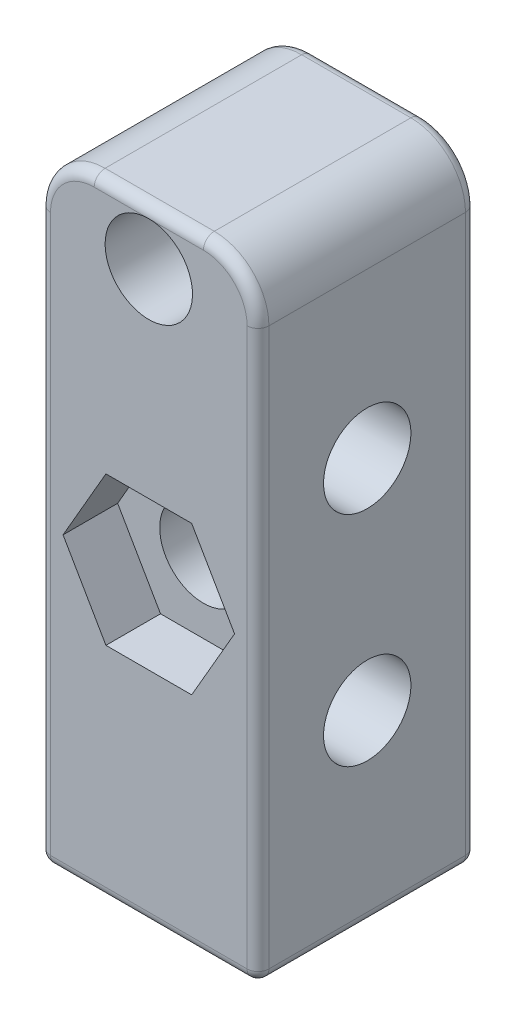
from build123d import *

# Parameters (mm, degrees)
SALIENTE_EXTRUIR1_DEPTH      = 50
SALIENTE_EXTRUIR1_DEPTH_BACK = 7
CROQUIS1_W                   = 20
CROQUIS1_H                   = 20
CROQUIS2_R                   = 4
CORTAR_EXTRUIR1_DEPTH        = 58.445626465
CORTAR_EXTRUIR2_DEPTH        = 5
CROQUIS4_R                   = 4
CORTAR_EXTRUIR3_DEPTH        = 58.445626465
CORTAR_EXTRUIR4_DEPTH        = 5
REDONDEO1_R                  = 5
REDONDEO2_R                  = 1
REDONDEO3_R                  = 1


with BuildPart() as part:
    # Croquis1 → Saliente-Extruir1 (new, two sides: drawn at the far end of the back side and taken through both)
    with BuildSketch(Plane(origin=(0, 0, 0), x_dir=(1, 0, 0), z_dir=(0, 1, 0)).offset(-SALIENTE_EXTRUIR1_DEPTH_BACK)):
        with Locations((10, 10)):
            Rectangle(CROQUIS1_W, CROQUIS1_H)
    extrude(amount=SALIENTE_EXTRUIR1_DEPTH + SALIENTE_EXTRUIR1_DEPTH_BACK)

    # Croquis2 → Cortar-Extruir1 (cut, through all)
    with BuildSketch(Plane.XY):
        with Locations((10, 45)):
            Circle(CROQUIS2_R)
        with Locations((10, 20)):
            Circle(CROQUIS2_R)
    extrude(amount=-CORTAR_EXTRUIR1_DEPTH, mode=Mode.SUBTRACT)

    # Croquis3 → Cortar-Extruir2 (cut)
    with BuildSketch(Plane.XY):
        Polygon((13.92598183, 26.8), (6.07401817, 26.8), (2.148036339, 20), (6.07401817, 13.2), (13.92598183, 13.2), (17.851963661, 20), align=None)
    extrude(amount=-CORTAR_EXTRUIR2_DEPTH, mode=Mode.SUBTRACT)

    # Croquis4 → Cortar-Extruir3 (cut, through all)
    with BuildSketch(Plane.ZY):
        with Locations((-10, 30)):
            Circle(CROQUIS4_R)
        with Locations((-10, 10)):
            Circle(CROQUIS4_R)
    extrude(amount=-CORTAR_EXTRUIR3_DEPTH, mode=Mode.SUBTRACT)

    # Croquis5 → Cortar-Extruir4 (cut)
    with BuildSketch(Plane.ZY):
        Polygon((-6.07401817, 23.2), (-2.148036339, 30), (-6.07401817, 36.8), (-13.92598183, 36.8), (-17.851963661, 30), (-13.92598183, 23.2), align=None)
        Polygon((-6.07401817, 16.8), (-13.92598183, 16.8), (-17.851963661, 10), (-13.92598183, 3.2), (-6.07401817, 3.2), (-2.148036339, 10), align=None)
    extrude(amount=-CORTAR_EXTRUIR4_DEPTH, mode=Mode.SUBTRACT)

    # Redondeo1
    redondeo1_edges = [part.edges().sort_by_distance(p)[0] for p in [
        (0, 50, -10),
        (20, 50, -10),
    ]]
    fillet(redondeo1_edges, radius=REDONDEO1_R)

    # Redondeo2
    redondeo2_edges = [part.edges().sort_by_distance(p)[0] for p in [
        (20, -7, -10),
        (10, -7, -20),
        (0, -7, -10),
        (10, -7, 0),
    ]]
    fillet(redondeo2_edges, radius=REDONDEO2_R)

    # Redondeo3
    # the kernel refuses this fillet: 1 mm, written as the material it takes off along each edge
    with BuildSketch(Plane(origin=(19, -6, -19), x_dir=(0, 0, -1), z_dir=(1, 0, 0))) as redondeo3_piece_1_section:
        Polygon((0, 0), (REDONDEO3_R, 0), (REDONDEO3_R, -REDONDEO3_R), (0, -REDONDEO3_R), align=None)
    redondeo3_piece_1 = extrude(amount=REDONDEO3_R, mode=Mode.PRIVATE)
    redondeo3_piece_1 = redondeo3_piece_1 - Plane(origin=(19, -6, -19), x_dir=(0, 0.7071067811865475, 0.7071067811865475), z_dir=(1, 0, 0)) * Sphere(REDONDEO3_R, mode=Mode.PRIVATE)
    add(redondeo3_piece_1, mode=Mode.SUBTRACT)
    with BuildSketch(Plane(origin=(19, -6, -1), x_dir=(1, 0, 0), z_dir=(0, 0, 1))) as redondeo3_piece_2_section:
        Polygon((0, 0), (REDONDEO3_R, 0), (REDONDEO3_R, -REDONDEO3_R), (0, -REDONDEO3_R), align=None)
    redondeo3_piece_2 = extrude(amount=REDONDEO3_R, mode=Mode.PRIVATE)
    redondeo3_piece_2 = redondeo3_piece_2 - Plane(origin=(19, -6, -1), x_dir=(-0.7071067811865475, 0.7071067811865475, 0), z_dir=(0, 0, 1)) * Sphere(REDONDEO3_R, mode=Mode.PRIVATE)
    add(redondeo3_piece_2, mode=Mode.SUBTRACT)
    with BuildSketch(Plane(origin=(1, -6, -19), x_dir=(0, 0, -1), z_dir=(-1, 0, 0))) as redondeo3_piece_3_section:
        Polygon((0, 0), (REDONDEO3_R, 0), (REDONDEO3_R, REDONDEO3_R), (0, REDONDEO3_R), align=None)
    redondeo3_piece_3 = extrude(amount=REDONDEO3_R, mode=Mode.PRIVATE)
    redondeo3_piece_3 = redondeo3_piece_3 - Plane(origin=(1, -6, -19), x_dir=(0, 0.7071067811865475, 0.7071067811865475), z_dir=(-1, 0, 0)) * Sphere(REDONDEO3_R, mode=Mode.PRIVATE)
    add(redondeo3_piece_3, mode=Mode.SUBTRACT)
    with BuildSketch(Plane(origin=(1, -6, -1), x_dir=(-1, 0, 0), z_dir=(0, 0, 1))) as redondeo3_piece_4_section:
        Polygon((0, 0), (REDONDEO3_R, 0), (REDONDEO3_R, REDONDEO3_R), (0, REDONDEO3_R), align=None)
    redondeo3_piece_4 = extrude(amount=REDONDEO3_R, mode=Mode.PRIVATE)
    redondeo3_piece_4 = redondeo3_piece_4 - Plane(origin=(1, -6, -1), x_dir=(0.7071067811865475, 0.7071067811865475, 0), z_dir=(0, 0, 1)) * Sphere(REDONDEO3_R, mode=Mode.PRIVATE)
    add(redondeo3_piece_4, mode=Mode.SUBTRACT)
    with BuildSketch(Plane(origin=(5, 50, 0), x_dir=(0, -1, 0), z_dir=(1, 0, 0))) as redondeo3_piece_5:
        with BuildLine():
            CenterArc((REDONDEO3_R, REDONDEO3_R), REDONDEO3_R, 180, 90)
            Line((0, REDONDEO3_R), (0, 0))
            Line((0, 0), (REDONDEO3_R, 0))
        make_face()
    extrude(amount=10, mode=Mode.SUBTRACT)
    with BuildSketch(Plane(origin=(15, 50, -20), x_dir=(0, 0, 1), z_dir=(-1, 0, 0))) as redondeo3_piece_6:
        with BuildLine():
            CenterArc((REDONDEO3_R, -REDONDEO3_R), REDONDEO3_R, 90, 90)
            Line((0, -REDONDEO3_R), (0, 0))
            Line((0, 0), (REDONDEO3_R, 0))
        make_face()
    extrude(amount=10, mode=Mode.SUBTRACT)
    with BuildSketch(Plane(origin=(5, 45, -20), x_dir=(-1, 0, 0), z_dir=(0, -1, 0))) as redondeo3_piece_7:
        with BuildLine():
            CenterArc((5 - REDONDEO3_R, -REDONDEO3_R), REDONDEO3_R, 0, 90)
            Line((5 - REDONDEO3_R, 0), (5, 0))
            Line((5, 0), (5, -REDONDEO3_R))
        make_face()
    revolve(axis=Axis((5, 45, -20), (0, 0, -1)), revolution_arc=90, mode=Mode.SUBTRACT)
    with BuildSketch(Plane(origin=(15, 45, -20), x_dir=(0, 1, 0), z_dir=(-1, 0, 0))) as redondeo3_piece_8:
        with BuildLine():
            CenterArc((5 - REDONDEO3_R, -REDONDEO3_R), REDONDEO3_R, 0, 90)
            Line((5 - REDONDEO3_R, 0), (5, 0))
            Line((5, 0), (5, -REDONDEO3_R))
        make_face()
    revolve(axis=Axis((15, 45, -20), (0, 0, -1)), revolution_arc=90, mode=Mode.SUBTRACT)
    with BuildSketch(Plane(origin=(5, 45, 0), x_dir=(-1, 0, 0), z_dir=(0, -1, 0))) as redondeo3_piece_9:
        with BuildLine():
            CenterArc((5 - REDONDEO3_R, REDONDEO3_R), REDONDEO3_R, 270, 90)
            Line((5, REDONDEO3_R), (5, 0))
            Line((5, 0), (5 - REDONDEO3_R, 0))
        make_face()
    revolve(axis=Axis((5, 45, 0), (0, 0, -1)), revolution_arc=90, mode=Mode.SUBTRACT)
    with BuildSketch(Plane(origin=(15, 45, 0), x_dir=(0, 1, 0), z_dir=(-1, 0, 0))) as redondeo3_piece_10:
        with BuildLine():
            CenterArc((5 - REDONDEO3_R, REDONDEO3_R), REDONDEO3_R, 270, 90)
            Line((5, REDONDEO3_R), (5, 0))
            Line((5, 0), (5 - REDONDEO3_R, 0))
        make_face()
    revolve(axis=Axis((15, 45, 0), (0, 0, -1)), revolution_arc=90, mode=Mode.SUBTRACT)
    with BuildSketch(Plane(origin=(0, 45, 0), x_dir=(1, 0, 0), z_dir=(0, -1, 0)), Plane(origin=(0, 45, -20), x_dir=(0, 0, 1), z_dir=(0, -1, 0)), Plane(origin=(20, -6, -20), x_dir=(0, 0, 1), z_dir=(0, 1, 0)), Plane(origin=(20, -6, 0), x_dir=(-1, 0, 0), z_dir=(0, 1, 0))) as redondeo3_piece_11:
        with BuildLine():
            CenterArc((REDONDEO3_R, -REDONDEO3_R), REDONDEO3_R, 90, 90)
            Line((0, -REDONDEO3_R), (0, 0))
            Line((0, 0), (REDONDEO3_R, 0))
        make_face()
    extrude(amount=51, mode=Mode.SUBTRACT)


solid = part.part
